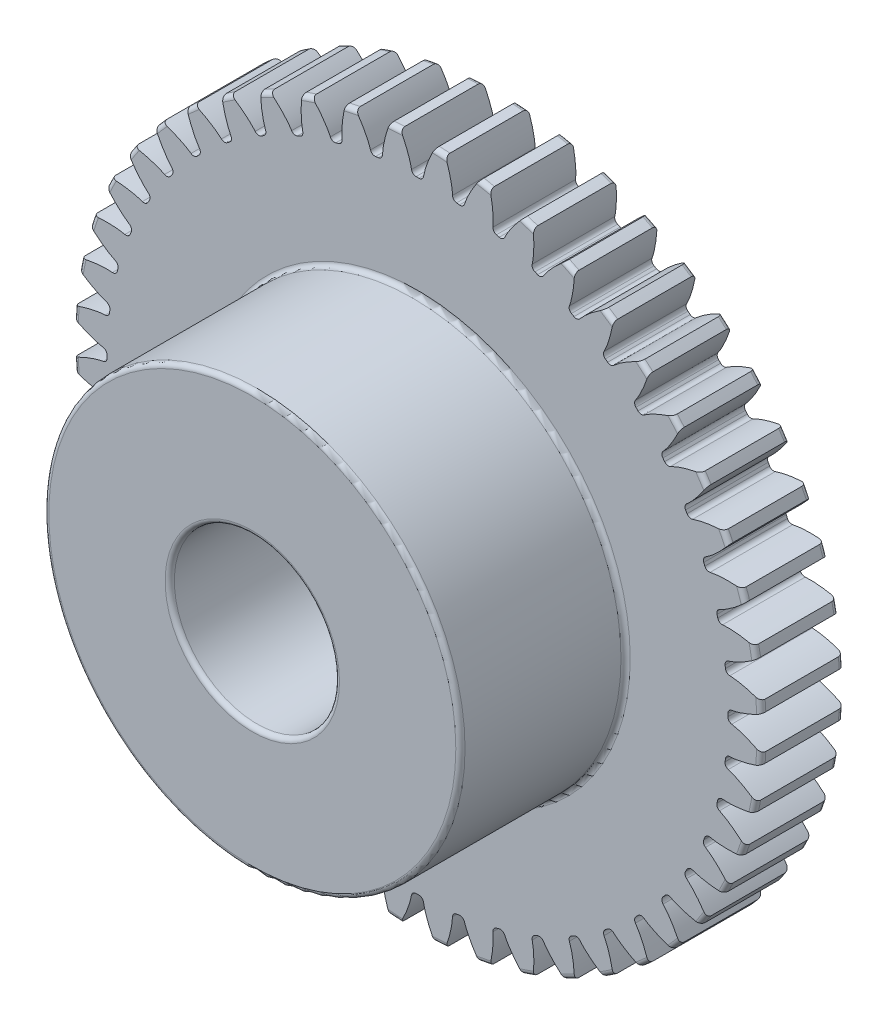
from build123d import *

# Parameters (mm, degrees)
BOSS_EXTRUDE1_DEPTH      = 4.7625
BOSS_EXTRUDE1_DEPTH_BACK = 4.7625
SKETCH3_R                = 13.229166667
SKETCH5_W                = 6.35
SKETCH5_H                = 5.228166667
SKETCH5_W_2              = 9.525
SKETCH5_H_2              = 3.175
FILLET2_R                = 0.177538081
CUT_EXTRUDE1_DEPTH       = 20.305520271
FILLET1_R                = 0.177538081
CIRPATTERN1_COUNT        = 48
FILLET1_OF_CIRPATTERN1_R = 0.177538081


with BuildPart() as part:
    # Sketch3 → Boss-Extrude1 (new, two sides: drawn at the far end of the back side and taken through both)
    with BuildSketch(Plane.XY.offset(-BOSS_EXTRUDE1_DEPTH_BACK)):
        Circle(SKETCH3_R)
    extrude(amount=BOSS_EXTRUDE1_DEPTH + BOSS_EXTRUDE1_DEPTH_BACK)

    # Sketch5 → Cut-Revolve1 (revolve, cut)
    with BuildSketch(Plane(origin=(0, 0, 0), x_dir=(0, 0, -1), z_dir=(1, 0, 0)), mode=Mode.PRIVATE) as cut_revolve1_sk:
        with Locations((-1.5875, 10.615083334)):
            Rectangle(SKETCH5_W, SKETCH5_H)
        with Locations((0, 1.5875)):
            Rectangle(SKETCH5_W_2, SKETCH5_H_2)
    revolve(cut_revolve1_sk.sketch.rotate(Axis((0, 0, 4.7625), (0, 0, -1)), 90), axis=Axis((0, 0, 4.7625), (0, 0, -1)), mode=Mode.SUBTRACT)

    # Fillet2
    fillet2_edges = [part.edges().sort_by_distance(p)[0] for p in [
        (-3.175, 0, 4.7625),
        (-3.175, 0, -4.7625),
        (-8.001, 0, 4.7625),
        (-8.001, 0, -1.5875),
        (-13.229166667, 0, -1.5875),
        (-13.229166667, 0, -4.7625),
    ]]
    fillet(fillet2_edges, radius=FILLET2_R)

    # Sketch4 → Cut-Extrude1 (cut, symmetric)
    with BuildSketch(Plane.XY):
        with BuildLine():
            ThreePointArc((11.932074389, 0.212658516), (11.933969284, 0), (11.932201369, -0.212660779))
            add(Edge.make_bspline(
                [(11.932201369, -0.212660779), (11.934219485, -0.212717179), (11.939878545, -0.212938639), (11.950572169, -0.213607197), (11.96801338, -0.215053108), (11.990223234, -0.217417388), (12.018912857, -0.221072811), (12.052685397, -0.226150351), (12.089772396, -0.232538871), (12.130087993, -0.240362214), (12.170276341, -0.24893927), (12.21033352, -0.258214333), (12.250205367, -0.268102395), (12.298462883, -0.280846952), (12.356270454, -0.297195047), (12.423746985, -0.317857891), (12.500161506, -0.343127611), (12.577910666, -0.370845697), (12.654305415, -0.399734381), (12.731356883, -0.43078019), (12.805811965, -0.462134729), (12.883001062, -0.496607647), (12.954175712, -0.529396299), (13.033746126, -0.568241958), (13.097910552, -0.600206527), (13.164044277, -0.634987314), (13.196210008, -0.652175364), (13.21263934, -0.661069106)],
                knots=[0, 0, 0, 0, 0, 0.005376749, 0.015083688, 0.02853182, 0.04661014, 0.064854849, 0.092110526, 0.119476176, 0.146842496, 0.174208854, 0.201574956, 0.228941013, 0.256307345, 0.307035032, 0.361767352, 0.416499661, 0.471231937, 0.525964282, 0.580696616, 0.635428982, 0.690161387, 0.744893688, 0.799626082, 0.854358407, 0.909090914, 0.909090914, 0.909090914, 0.909090914, 0.909090914], degree=4))
            ThreePointArc((13.21263934, -0.661069106), (13.229166667, 0), (13.21263934, 0.661069106))
            add(Edge.make_bspline(
                [(11.932074389, 0.212658516), (11.934219485, 0.212717179), (11.939878545, 0.212938639), (11.950572169, 0.213607197), (11.96801338, 0.215053108), (11.990223234, 0.217417388), (12.018912857, 0.221072811), (12.052685397, 0.226150351), (12.089772396, 0.232538871), (12.130087993, 0.240362214), (12.170276341, 0.24893927), (12.21033352, 0.258214333), (12.250205367, 0.268102395), (12.298462883, 0.280846952), (12.356270454, 0.297195047), (12.423746985, 0.317857891), (12.500161506, 0.343127611), (12.577910666, 0.370845697), (12.654305415, 0.399734381), (12.731356883, 0.43078019), (12.805811965, 0.462134729), (12.883001062, 0.496607647), (12.954175712, 0.529396299), (13.033746126, 0.568241958), (13.097910552, 0.600206527), (13.164044277, 0.634987314), (13.196210008, 0.652175364), (13.21263934, 0.661069106)],
                knots=[0, 0, 0, 0, 0, 0.005376749, 0.015083688, 0.02853182, 0.04661014, 0.064854849, 0.092110526, 0.119476176, 0.146842496, 0.174208854, 0.201574956, 0.228941013, 0.256307345, 0.307035032, 0.361767352, 0.416499661, 0.471231937, 0.525964282, 0.580696616, 0.635428982, 0.690161387, 0.744893688, 0.799626082, 0.854358407, 0.909090914, 0.909090914, 0.909090914, 0.909090914, 0.909090914], degree=4))
        make_face()
    cut_extrude1 = extrude(amount=CUT_EXTRUDE1_DEPTH, both=True, mode=Mode.SUBTRACT)

    # Fillet1
    fillet1_edges = [part.edges().sort_by_distance(p)[0] for p in [
        (11.932201369, -0.212660779, -3.175),
        (11.932074389, 0.212658516, -3.175),
    ]]
    fillet(fillet1_edges, radius=FILLET1_R)

    # CirPattern1: Cut-Extrude1 ×48 about axis
    cirpattern1_axis = Axis((0, 0, 4.7625), (0, 0, -1))
    for i in range(1, CIRPATTERN1_COUNT):
        add(cut_extrude1.rotate(cirpattern1_axis, i * 360 / CIRPATTERN1_COUNT), mode=Mode.SUBTRACT)

    # Fillet1 of CirPattern1
    fillet1_of_cirpattern1_edges = [part.edges().sort_by_distance(p)[0] for p in [
        (11.80236193, -1.768306246, -3.175),
        (11.857751345, -1.346609042, -3.175),
        (11.470580807, -3.293695503, -3.175),
        (11.580538888, -2.882835747, -3.175),
        (10.942534866, -4.762728717, -3.175),
        (11.105180199, -4.369736332, -3.175),
        (10.227259119, -6.150270322, -3.175),
        (10.439808799, -5.781869517, -3.175),
        (9.336992133, -7.432579096, -3.175),
        (9.595809375, -7.095073312, -3.175),
        (8.286966623, -8.587714382, -3.175),
        (8.587622993, -8.286878435, -3.175),
        (7.095148817, -9.595911493, -3.175),
        (7.4325, -9.336892771, -3.175),
        (5.781931047, -10.439919898, -3.175),
        (6.150204872, -10.227150283, -3.175),
        (4.369782834, -11.105298379, -3.175),
        (4.762678033, -10.942418418, -3.175),
        (2.882866425, -11.580662127, -3.175),
        (3.293660452, -11.47045874, -3.175),
        (1.346623373, -11.857877534, -3.175),
        (1.768287428, -11.802236332, -3.175),
        (-0.212660779, -11.932201369, -3.175),
        (0.212658516, -11.932074389, -3.175),
        (-1.768306246, -11.80236193, -3.175),
        (-1.346609042, -11.857751345, -3.175),
        (-3.293695503, -11.470580807, -3.175),
        (-2.882835747, -11.580538888, -3.175),
        (-4.762728717, -10.942534866, -3.175),
        (-4.369736332, -11.105180199, -3.175),
        (-6.150270322, -10.227259119, -3.175),
        (-5.781869517, -10.439808799, -3.175),
        (-7.432579096, -9.336992133, -3.175),
        (-7.095073312, -9.595809375, -3.175),
        (-8.587714382, -8.286966623, -3.175),
        (-8.286878435, -8.587622993, -3.175),
        (-9.595911493, -7.095148817, -3.175),
        (-9.336892771, -7.4325, -3.175),
        (-10.439919898, -5.781931047, -3.175),
        (-10.227150283, -6.150204872, -3.175),
        (-11.105298379, -4.369782834, -3.175),
        (-10.942418418, -4.762678033, -3.175),
        (-11.580662127, -2.882866425, -3.175),
        (-11.47045874, -3.293660452, -3.175),
        (-11.857877534, -1.346623373, -3.175),
        (-11.802236332, -1.768287428, -3.175),
        (-11.932201369, 0.212660779, -3.175),
        (-11.932074389, -0.212658516, -3.175),
        (-11.80236193, 1.768306246, -3.175),
        (-11.857751345, 1.346609042, -3.175),
        (-11.470580807, 3.293695503, -3.175),
        (-11.580538888, 2.882835747, -3.175),
        (-10.942534866, 4.762728717, -3.175),
        (-11.105180199, 4.369736332, -3.175),
        (-10.227259119, 6.150270322, -3.175),
        (-10.439808799, 5.781869517, -3.175),
        (-9.336992133, 7.432579096, -3.175),
        (-9.595809375, 7.095073312, -3.175),
        (-8.286966623, 8.587714382, -3.175),
        (-8.587622993, 8.286878435, -3.175),
        (-7.095148817, 9.595911493, -3.175),
        (-7.4325, 9.336892771, -3.175),
        (-5.781931047, 10.439919898, -3.175),
        (-6.150204872, 10.227150283, -3.175),
        (-4.369782834, 11.105298379, -3.175),
        (-4.762678033, 10.942418418, -3.175),
        (-2.882866425, 11.580662127, -3.175),
        (-3.293660452, 11.47045874, -3.175),
        (-1.346623373, 11.857877534, -3.175),
        (-1.768287428, 11.802236332, -3.175),
        (0.212660779, 11.932201369, -3.175),
        (-0.212658516, 11.932074389, -3.175),
        (1.768306246, 11.80236193, -3.175),
        (1.346609042, 11.857751345, -3.175),
        (3.293695503, 11.470580807, -3.175),
        (2.882835747, 11.580538888, -3.175),
        (4.762728717, 10.942534866, -3.175),
        (4.369736332, 11.105180199, -3.175),
        (6.150270322, 10.227259119, -3.175),
        (5.781869517, 10.439808799, -3.175),
        (7.432579096, 9.336992133, -3.175),
        (7.095073312, 9.595809375, -3.175),
        (8.587714382, 8.286966623, -3.175),
        (8.286878435, 8.587622993, -3.175),
        (9.595911493, 7.095148817, -3.175),
        (9.336892771, 7.4325, -3.175),
        (10.439919898, 5.781931047, -3.175),
        (10.227150283, 6.150204872, -3.175),
        (11.105298379, 4.369782834, -3.175),
        (10.942418418, 4.762678033, -3.175),
        (11.580662127, 2.882866425, -3.175),
        (11.47045874, 3.293660452, -3.175),
        (11.857877534, 1.346623373, -3.175),
        (11.802236332, 1.768287428, -3.175),
    ]]
    fillet(fillet1_of_cirpattern1_edges, radius=FILLET1_OF_CIRPATTERN1_R)


solid = part.part
